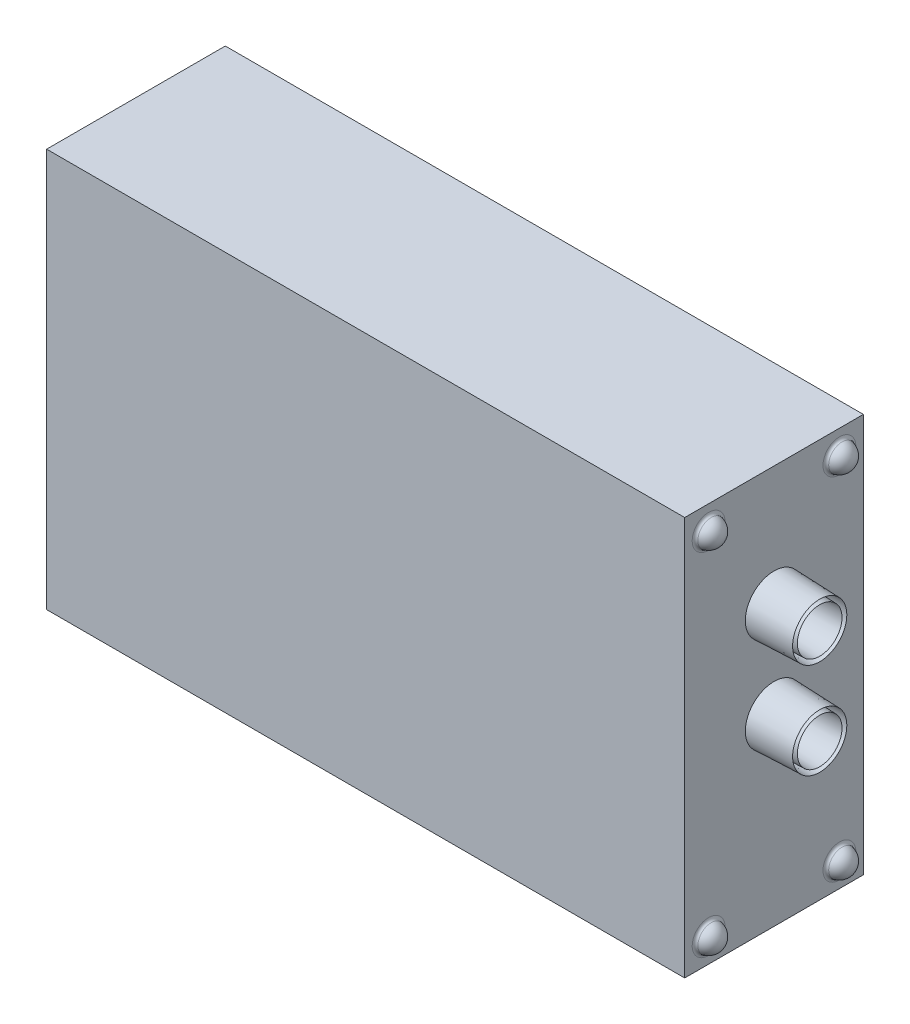
from build123d import *

# Parameters (mm, degrees)
SKETCH1_W                = 400
SKETCH1_H                = 250
BOSS_EXTRUDE1_DEPTH      = 112
SHELL1_T                 = -10
BOSS_EXTRUDE2_DEPTH      = 390
LPATTERN1_COUNT          = 26
LPATTERN1_PITCH          = 9
CUT_EXTRUDE1_DEPTH       = 340.181367413
CUT_EXTRUDE1_DEPTH_BACK  = 340.181367413
SKETCH3_W                = 10
SKETCH3_H                = 218.00428833
REVOLVE1_ANGLE           = 180
FILLET1_R                = 2
FILLET1_OF_MIRROR1_R     = 2
FILLET2_R                = 2
MIRROR21_COPY_1_ANGLE    = 180
MIRROR21_COPY_2_ANGLE    = 180
FILLET2_OF_MIRROR21_R    = 2
SKETCH6_R                = 13
CUT_EXTRUDE2_DEPTH       = 60
MIRROR24_COPY_2_SKETCH_R = 13
MIRROR24_COPY_2_DEPTH    = 60


# Read off the part's stored shape, not the designer's step: Mirror10, Mirror22, Extrude-Thin2
with BuildPart() as part:
    # Sketch1 → Boss-Extrude1 (new body)
    with BuildSketch(Plane.XY):
        Rectangle(SKETCH1_W, SKETCH1_H)
    extrude(amount=BOSS_EXTRUDE1_DEPTH)

    # Shell1
    shell1_openings = [part.faces().sort_by_distance(p)[0] for p in [
        (0, 0, 0),
    ]]
    offset(amount=SHELL1_T, openings=shell1_openings, kind=Kind.INTERSECTION)

    # Sketch2 → Boss-Extrude2 (add)
    with BuildSketch(Plane(origin=(200, 0, 0), x_dir=(0, 0, -1), z_dir=(1, 0, 0))):
        Polygon((-2, 117.5), (-2, 115.965761153), (0.553078335, 109.139841345), (2.367590096, 108.460164232), align=None)
    boss_extrude2 = extrude(amount=-BOSS_EXTRUDE2_DEPTH)

    # LPattern1: Boss-Extrude2 ×26
    with Locations(*[(0, -i * LPATTERN1_PITCH, 0) for i in range(1, LPATTERN1_COUNT)]):
        add(boss_extrude2)

    # Sketch3 → Cut-Extrude1 (cut, two sides: drawn at the far end of the back side and taken through both)
    with BuildSketch(Plane(origin=(0, 125, 0), x_dir=(1, 0, 0), z_dir=(0, 1, 0)).offset(-CUT_EXTRUDE1_DEPTH_BACK)):
        with Locations((195, 109.002144165)):
            Rectangle(SKETCH3_W, SKETCH3_H)
    extrude(amount=CUT_EXTRUDE1_DEPTH + CUT_EXTRUDE1_DEPTH_BACK, mode=Mode.SUBTRACT)

    # Sketch4 → Revolve1 (revolve)
    with BuildSketch(Plane(origin=(200, 0, 0), x_dir=(0, 0, -1), z_dir=(1, 0, 0))):
        with BuildLine():
            Line((-15, 118.5), (-15, 101.5))
            ThreePointArc((-15, 101.5), (-6.5, 110), (-15, 118.5))
        make_face()
    revolve1 = revolve(axis=Axis((200, 118.5, 15), (0, -1, 0)), revolution_arc=REVOLVE1_ANGLE)

    # Fillet1
    fillet1_edges = [part.edges().sort_by_distance(p)[0] for p in [
        (200, 110, 23.5),
    ]]
    fillet(fillet1_edges, radius=FILLET1_R)

    # Mirror1: Revolve1 across plane
    add(revolve1.mirror(Plane(origin=(0, 0, 56), x_dir=(1, 0, 0), z_dir=(0, 0, -1))))

    # Fillet1 of Mirror1
    fillet1_of_mirror1_edges = [part.edges().sort_by_distance(p)[0] for p in [
        (200, 110, 88.5),
    ]]
    fillet(fillet1_of_mirror1_edges, radius=FILLET1_OF_MIRROR1_R)

    # Mirror10 outline → Mirror10 (revolve)
    with BuildSketch(Plane(origin=(0, -110, 15), x_dir=(0, 1, 0), z_dir=(0, 0, -1))):
        with BuildLine():
            ThreePointArc((10.307764064, 200), (9.035346043, 200.4569665), (8.344380433, 201.619047619))
            ThreePointArc((8.344380433, 201.619047619), (5.407776591, 206.557892371), (0, 208.5))
            Line((0, 208.5), (0, 200))
            Line((0, 200), (10.307764064, 200))
        make_face()
    revolve(axis=Axis((0, -110, 15), (1, 0, 0)))

    # Mirror10 2 outline → Mirror10 2 (revolve)
    with BuildSketch(Plane(origin=(0, -110, 97), x_dir=(0, 1, 0), z_dir=(0, 0, -1))):
        with BuildLine():
            ThreePointArc((10.307764064, 200), (9.035346043, 200.4569665), (8.344380433, 201.619047619))
            ThreePointArc((8.344380433, 201.619047619), (5.407776591, 206.557892371), (0, 208.5))
            Line((0, 208.5), (0, 200))
            Line((0, 200), (10.307764064, 200))
        make_face()
    revolve(axis=Axis((0, -110, 97), (1, 0, 0)))

    # Mirror15: Revolve1 across plane
    add(revolve1.mirror(Plane.ZY))

    # Fillet2
    fillet2_edges = [part.edges().sort_by_distance(p)[0] for p in [
        (-200, 110, 6.5),
    ]]
    fillet(fillet2_edges, radius=FILLET2_R)

    # Mirror21 copy 1 sketch → Mirror21 copy 1 (revolve)
    with BuildSketch(Plane(origin=(-200, 0, 0), x_dir=(0, 0, -1), z_dir=(-1, 0, 0))):
        with BuildLine():
            Line((-15, 118.5), (-15, 101.5))
            ThreePointArc((-15, 101.5), (-6.5, 110), (-15, 118.5))
        make_face()
    revolve(axis=Axis((-200, -118.5, 15), (0, 1, 0)), revolution_arc=MIRROR21_COPY_1_ANGLE)

    # Mirror21 copy 2 sketch → Mirror21 copy 2 (revolve)
    with BuildSketch(Plane(origin=(200, 0, 0), x_dir=(0, 0, -1), z_dir=(1, 0, 0))):
        with BuildLine():
            Line((-15, -118.5), (-15, -101.5))
            ThreePointArc((-15, -101.5), (-6.5, -110), (-15, -118.5))
        make_face()
    revolve(axis=Axis((200, -118.5, 15), (0, -1, 0)), revolution_arc=MIRROR21_COPY_2_ANGLE)

    # Fillet2 of Mirror21
    fillet2_of_mirror21_edges = [part.edges().sort_by_distance(p)[0] for p in [
        (-200, -110, 6.5),
    ]]
    fillet(fillet2_of_mirror21_edges, radius=FILLET2_OF_MIRROR21_R)

    # Mirror22 outline → Mirror22 (revolve)
    with BuildSketch(Plane(origin=(0, -110, 97), x_dir=(0, 1, 0), z_dir=(0, 0, -1))):
        with BuildLine():
            Line((0, -200), (0, -208.5))
            ThreePointArc((0, -208.5), (5.407776591, -206.557892371), (8.344380434, -201.619047611))
            ThreePointArc((8.344380434, -201.619047611), (9.035346043, -200.4569665), (10.307764064, -200))
            Line((10.307764064, -200), (0, -200))
        make_face()
    revolve(axis=Axis((0, -110, 97), (1, 0, 0)))

    # Mirror22 2 outline → Mirror22 2 (revolve)
    with BuildSketch(Plane(origin=(0, 110, 97), x_dir=(0, 1, 0), z_dir=(0, 0, -1))):
        with BuildLine():
            Line((0, -200), (0, -208.5))
            ThreePointArc((0, -208.5), (5.407776591, -206.557892371), (8.344380434, -201.619047611))
            ThreePointArc((8.344380434, -201.619047611), (9.035346043, -200.4569665), (10.307764064, -200))
            Line((10.307764064, -200), (0, -200))
        make_face()
    revolve(axis=Axis((0, 110, 97), (1, 0, 0)))

    # Extrude-Thin2 outline → Extrude-Thin2 (revolve)
    with BuildSketch(Plane(origin=(0, 50, 56), x_dir=(0, 1, 0), z_dir=(0, 0, -1))):
        Polygon((17, 228.636253283), (16, 200), (18, 200), align=None)
        Polygon((13, 200), (15, 200), (14, 228.636253283), align=None)
    extrude_thin2 = revolve(axis=Axis((0, 50, 56), (1, 0, 0)))

    # Sketch6 → Cut-Extrude2 (cut)
    with BuildSketch(Plane(origin=(200, 0, 0), x_dir=(0, 0, -1), z_dir=(1, 0, 0))):
        with Locations((-56, 50)):
            Circle(SKETCH6_R)
    cut_extrude2 = extrude(amount=-CUT_EXTRUDE2_DEPTH, mode=Mode.SUBTRACT)

    # Mirror23: Extrude-Thin2, Cut-Extrude2 across plane
    add(extrude_thin2.mirror(Plane.ZY))
    add(cut_extrude2.mirror(Plane.ZY), mode=Mode.SUBTRACT)

    # Mirror24: Extrude-Thin2, Cut-Extrude2 across plane
    add(extrude_thin2.mirror(Plane.ZX.offset(20)))
    add(cut_extrude2.mirror(Plane.ZX.offset(20)), mode=Mode.SUBTRACT)

    # Mirror24 copy 1 sketch → Mirror24 copy 1 (revolve)
    with BuildSketch(Plane(origin=(0, -10, 56), x_dir=(0, -1, 0), z_dir=(0, 0, -1))):
        Polygon((17, 228.636253283), (16, 200), (18, 200), align=None)
        Polygon((13, 200), (15, 200), (14, 228.636253283), align=None)
    revolve(axis=Axis((0, -10, 56), (-1, 0, 0)))

    # Mirror24 copy 2 sketch → Mirror24 copy 2 (cut)
    with BuildSketch(Plane(origin=(-200, 40, 0), x_dir=(0, 0, -1), z_dir=(-1, 0, 0))):
        with Locations((-56, 50)):
            Circle(MIRROR24_COPY_2_SKETCH_R)
    extrude(amount=-MIRROR24_COPY_2_DEPTH, mode=Mode.SUBTRACT)


solid = part.part
